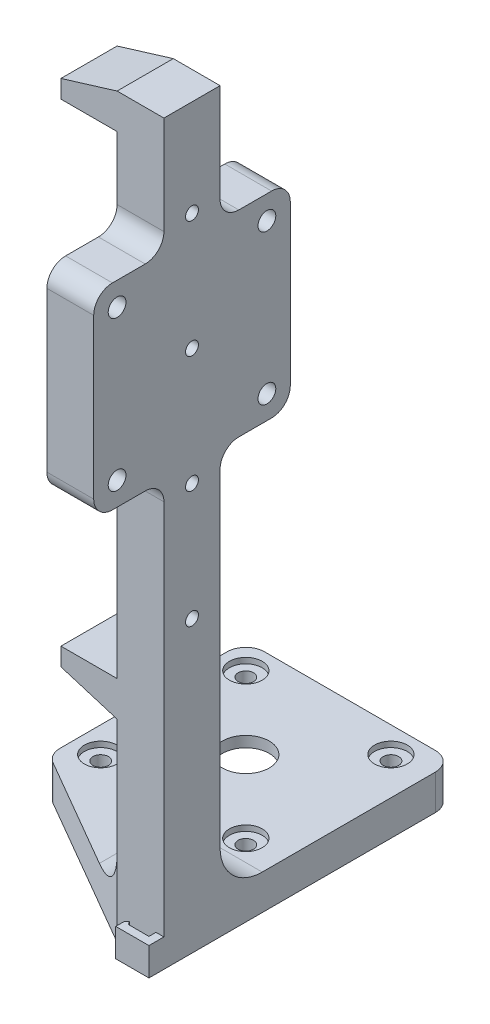
from build123d import *

# Parameters (mm, degrees)
SKETCH1_W           = 42
SKETCH1_H           = 42
SKETCH1_R           = 1.9
BOSS_EXTRUDE1_DEPTH = 10
SKETCH2_W           = 12
SKETCH2_H           = 150
BOSS_EXTRUDE2_DEPTH = 10
SKETCH3_W           = 12
SKETCH3_H           = 3.75
BOSS_EXTRUDE3_DEPTH = 12
CHAMFER1_SIZE       = 3.75
CHAMFER1_SIZE_2     = 12.265697319
SKETCH4_R           = 1.375
CUT_EXTRUDE1_DEPTH  = 12
SKETCH5_W           = 42
SKETCH5_H           = 42
SKETCH5_R           = 1.65
SKETCH5_R_2         = 5
BOSS_EXTRUDE4_DEPTH = 7.5
SKETCH6_R           = 12.5
CUT_EXTRUDE2_DEPTH  = 5.2
FILLET1_R           = 4
FILLET2_R           = 9
SKETCH8_R           = 3.5
CUT_EXTRUDE4_DEPTH  = 1.2
BOSS_EXTRUDE7_DEPTH = 6


with BuildPart() as part:
    # Sketch1 → Boss-Extrude1 (new body)
    with BuildSketch(Plane(origin=(0, 0, 0), x_dir=(0, 0, -1), z_dir=(1, 0, 0))):
        Rectangle(SKETCH1_W, SKETCH1_H)
        with Locations((16, -16)):
            Circle(SKETCH1_R, mode=Mode.SUBTRACT)
        with Locations((-16, -16)):
            Circle(SKETCH1_R, mode=Mode.SUBTRACT)
        with Locations((-16, 16)):
            Circle(SKETCH1_R, mode=Mode.SUBTRACT)
        with Locations((16, 16)):
            Circle(SKETCH1_R, mode=Mode.SUBTRACT)
    extrude(amount=BOSS_EXTRUDE1_DEPTH)

    # Sketch2 → Boss-Extrude2 (add)
    with BuildSketch(Plane.ZY):
        with Locations((0, -29)):
            Rectangle(SKETCH2_W, SKETCH2_H)
    extrude(amount=-BOSS_EXTRUDE2_DEPTH)

    # Sketch3 → Boss-Extrude3 (add)
    with BuildSketch(Plane.ZY):
        with Locations((0, 40.375)):
            Rectangle(SKETCH3_W, SKETCH3_H)
        with Locations((0, -64.575)):
            Rectangle(SKETCH3_W, SKETCH3_H)
    extrude(amount=BOSS_EXTRUDE3_DEPTH)

    # Chamfer1
    # the kernel refuses this chamfer: 12.265697319, 3.75 mm, written as the material it adds along each edge
    with BuildSketch(Plane(origin=(0, 42.25, -6), x_dir=(0.11964200288050787, 0.9928170985366542, 0), z_dir=(0, 0, 1))) as chamfer1_piece_1_section:
        Polygon((CHAMFER1_SIZE * 0.992817098537, CHAMFER1_SIZE * 0.119642002881), (-CHAMFER1_SIZE_2 * 0.119642002884, CHAMFER1_SIZE_2 * 0.992817098562), (0, 0), align=None)
    chamfer1_piece_1 = extrude(amount=12, mode=Mode.PRIVATE)
    chamfer1_piece_1 = split(chamfer1_piece_1, bisect_by=Plane(origin=(-4.172539525, 46, 0), z_dir=(0, -1, 0)), keep=Keep.TOP, mode=Mode.PRIVATE)
    chamfer1_piece_1 = split(chamfer1_piece_1, bisect_by=Plane(origin=(-12, 43.383581674, 0), z_dir=(1, 0, 0)), keep=Keep.TOP, mode=Mode.PRIVATE)
    add(chamfer1_piece_1)
    with BuildSketch(Plane(origin=(0, -66.45, -6), x_dir=(0.11964200288050787, -0.9928170985366542, 0), z_dir=(0, 0, 1))) as chamfer1_piece_2_section:
        Polygon((CHAMFER1_SIZE * 0.992817098537, -CHAMFER1_SIZE * 0.119642002881), (-CHAMFER1_SIZE_2 * 0.119642002884, -CHAMFER1_SIZE_2 * 0.992817098562), (0, 0), align=None)
    chamfer1_piece_2 = extrude(amount=12, mode=Mode.PRIVATE)
    chamfer1_piece_2 = split(chamfer1_piece_2, bisect_by=Plane(origin=(-12, -67.58994207, 0), z_dir=(1, 0, 0)), keep=Keep.TOP, mode=Mode.PRIVATE)
    add(chamfer1_piece_2)

    # Sketch4 → Cut-Extrude1 (cut)
    with BuildSketch(Plane.ZY):
        with Locations((0, 25.4)):
            Circle(SKETCH4_R)
        with Locations((0, 0.4)):
            Circle(SKETCH4_R)
        with Locations((0, -24.6)):
            Circle(SKETCH4_R)
        with Locations((0, -49.6)):
            Circle(SKETCH4_R)
    extrude(amount=-CUT_EXTRUDE1_DEPTH, mode=Mode.SUBTRACT)

    # Sketch5 → Boss-Extrude4 (add)
    # profile 1 of 2: a face of its own
    with BuildSketch(Plane.XZ.offset(104)):
        Polygon((10, -56), (10, 6), (0, 6), (-34.5, -14), (7.5, -14), (7.5, -56), align=None)
    # profile 2 of 2: a face of its own
    with BuildSketch(Plane.XZ.offset(104)):
        with Locations((-13.5, -35)):
            Rectangle(SKETCH5_W, SKETCH5_H)
        with Locations(Location((-29, -50.5, 0), (0, 0, 270))):
            Circle(SKETCH5_R, mode=Mode.SUBTRACT)
        with Locations(Location((-13.5, -35, 0), (0, 0, 270))):
            Circle(SKETCH5_R_2, mode=Mode.SUBTRACT)
        with Locations(Location((2, -50.5, 0), (0, 0, 270))):
            Circle(SKETCH5_R, mode=Mode.SUBTRACT)
        with Locations(Location((-29, -19.5, 0), (0, 0, 270))):
            Circle(SKETCH5_R, mode=Mode.SUBTRACT)
        with Locations(Location((2, -19.5, 0), (0, 0, 270))):
            Circle(SKETCH5_R, mode=Mode.SUBTRACT)
    extrude(amount=BOSS_EXTRUDE4_DEPTH)

    # Sketch6 → Cut-Extrude2 (cut)
    with BuildSketch(Plane.XZ.offset(111.5)):
        with Locations(Location((-13.5, -35, 0), (0, 0, 270))):
            Circle(SKETCH6_R)
    extrude(amount=-CUT_EXTRUDE2_DEPTH, mode=Mode.SUBTRACT)

    # Fillet1
    fillet1_edges = [part.edges().sort_by_distance(p)[0] for p in [
        (-34.5, -107.75, -56),
        (10, -107.75, -56),
        (-34.5, -107.75, -14),
        (5, -21, 6),
        (5, -21, -6),
        (5, 21, -6),
        (5, 21, 6),
        (5, -21, -21),
        (5, -21, 21),
        (5, 21, 21),
        (5, 21, -21),
    ]]
    fillet(fillet1_edges, radius=FILLET1_R)

    # Fillet2
    fillet2_edges = [part.edges().sort_by_distance(p)[0] for p in [
        (5, -104, -6),
        (0, -104, 0),
    ]]
    fillet(fillet2_edges, radius=FILLET2_R)

    # Sketch8 → Cut-Extrude4 (cut)
    with BuildSketch(Plane(origin=(0, -104, 0), x_dir=(1, 0, 0), z_dir=(0, 1, 0))):
        with Locations(Location((-29, 50.5, 0), (0, 0, 270))):
            Circle(SKETCH8_R)
        with Locations(Location((2, 50.5, 0), (0, 0, 270))):
            Circle(SKETCH8_R)
        with Locations(Location((2, 19.5, 0), (0, 0, 270))):
            Circle(SKETCH8_R)
        with Locations(Location((-29, 19.5, 0), (0, 0, 270))):
            Circle(SKETCH8_R)
    extrude(amount=-CUT_EXTRUDE4_DEPTH, mode=Mode.SUBTRACT)

    # Sketch11 → Boss-Extrude7 (add)
    with BuildSketch(Plane.XZ.offset(111.5)):
        Polygon((8.3, 6), (10, 6), (10, 9.2), (2.9, 9.2), (2.9, 7.5), (3.9, 7.5), (8.3, 7.5), align=None)
        Polygon((3.9, 7.5), (2.9, 7.5), (3.433368825, 6.8), align=None)
    extrude(amount=-BOSS_EXTRUDE7_DEPTH)


solid = part.part
